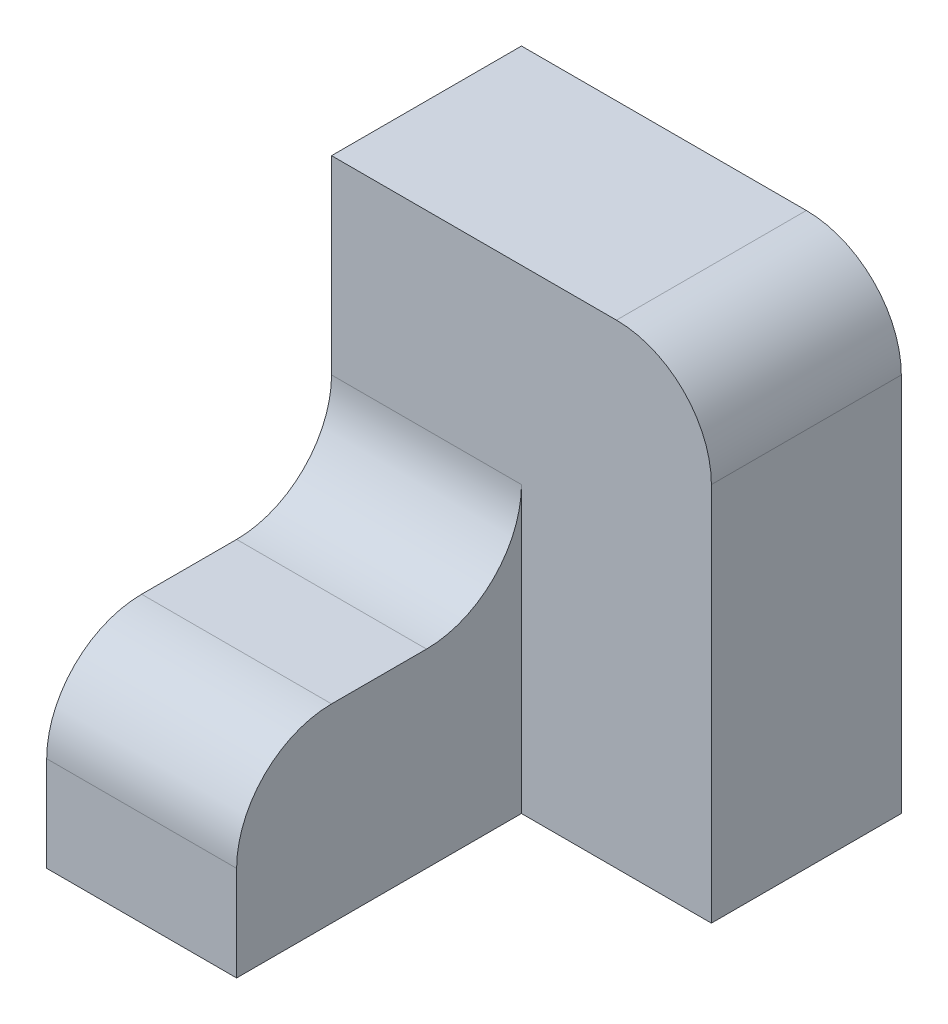
from build123d import *

# Parameters (mm, degrees)
SKETCH1_W           = 40
SKETCH1_H           = 20
BOSS_EXTRUDE1_DEPTH = 50
SKETCH1_6_W         = 20
SKETCH1_6_H         = 30
BOSS_EXTRUDE4_DEPTH = 20
FILLET2_R           = 10


with BuildPart() as part:
    # Sketch1 → Boss-Extrude1 (new body)
    with BuildSketch(Plane(origin=(0, 0, 0), x_dir=(1, 0, 0), z_dir=(0, 1, 0))):
        with Locations((20, 40)):
            Rectangle(SKETCH1_W, SKETCH1_H)
    extrude(amount=BOSS_EXTRUDE1_DEPTH)

    # Sketch1<6> → Boss-Extrude4 (add)
    with BuildSketch(Plane(origin=(0, 0, 0), x_dir=(1, 0, 0), z_dir=(0, 1, 0))):
        with Locations((10, 15)):
            Rectangle(SKETCH1_6_W, SKETCH1_6_H)
    extrude(amount=BOSS_EXTRUDE4_DEPTH)

    # Fillet2
    fillet2_edges = [part.edges().sort_by_distance(p)[0] for p in [
        (40, 50, -40),
        (10, 20, -30),
        (10, 20, 0),
    ]]
    fillet(fillet2_edges, radius=FILLET2_R)


solid = part.part
